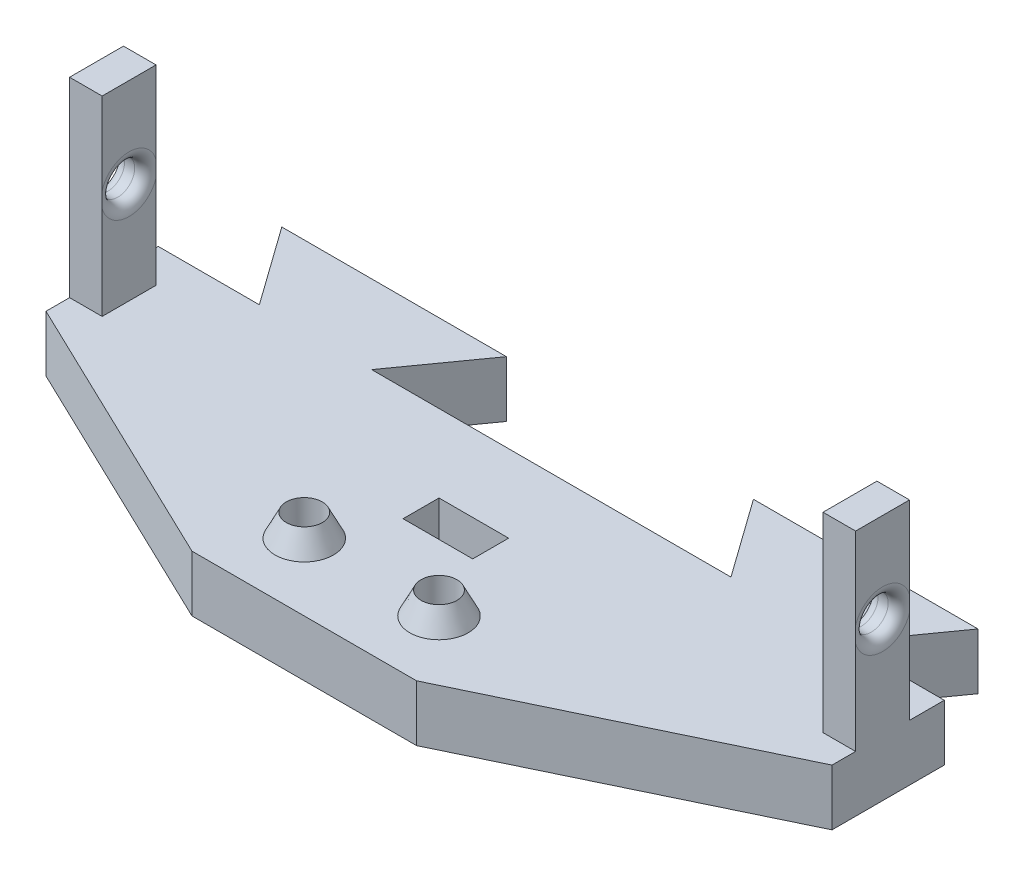
from build123d import *

# Parameters (mm, degrees)
BOSS_EXTRUDE1_DEPTH = 5
SKETCH2_R           = 1.6
CUT_EXTRUDE1_DEPTH  = 3
SKETCH10_W          = 2.9
SKETCH10_H          = 4.8
BOSS_EXTRUDE2_DEPTH = 17
SKETCH9_W           = 6.2
SKETCH9_H           = 3.2
CUT_EXTRUDE4_DEPTH  = 5
SKETCH11_R          = 1.5
CUT_EXTRUDE5_DEPTH  = 70
FILLET3_R           = 1
FILLET4_R           = 1
FILLET6_R           = 1
FILLET7_R           = 1
BOSS_EXTRUDE4_DEPTH = 5


with BuildPart() as part:
    # Sketch1 → Boss-Extrude1 (new body)
    with BuildSketch(Plane(origin=(0, 0, 0), x_dir=(1, 0, 0), z_dir=(0, 1, 0))):
        Polygon((0, 0), (20, 0), (45, 12), (45, 22), (-25, 22), (-25, 12), align=None)
    extrude(amount=BOSS_EXTRUDE1_DEPTH)

    # Sketch2 → Cut-Extrude1 (cut)
    with BuildSketch(Plane(origin=(0, 5, 0), x_dir=(1, 0, 0), z_dir=(0, 1, 0))):
        with Locations(Location((4, 6, 0), (0, 0, 270))):
            Circle(SKETCH2_R)
        with Locations(Location((16, 6, 0), (0, 0, 90))):
            Circle(SKETCH2_R)
    extrude(amount=-CUT_EXTRUDE1_DEPTH, mode=Mode.SUBTRACT)

    # Sketch6 → Revolve1 (revolve)
    with BuildSketch(Plane.XY.offset(-6), mode=Mode.PRIVATE) as revolve1_sk:
        Polygon((2.4, 5), (2.4, 7), (1.4, 5), align=None)
    revolve(revolve1_sk.sketch.rotate(Axis((4, 5, -6), (0, 1, 0)), 270), axis=Axis((4, 5, -6), (0, 1, 0)))

    # Sketch7 → Revolve2 (revolve)
    with BuildSketch(Plane.XY.offset(-6), mode=Mode.PRIVATE) as revolve2_sk:
        Polygon((14.4, 5), (14.4, 7), (13.4, 5), align=None)
    revolve(revolve2_sk.sketch.rotate(Axis((16, 5, -6), (0, 1, 0)), 270), axis=Axis((16, 5, -6), (0, 1, 0)))

    # Sketch10 → Boss-Extrude2 (add)
    with BuildSketch(Plane(origin=(0, 5, 0), x_dir=(1, 0, 0), z_dir=(0, 1, 0))):
        with Locations((-23.55, 16.5)):
            Rectangle(SKETCH10_W, SKETCH10_H)
        with Locations((43.55, 16.5)):
            Rectangle(SKETCH10_W, SKETCH10_H)
    extrude(amount=BOSS_EXTRUDE2_DEPTH)

    # Sketch9 → Cut-Extrude4 (cut)
    with BuildSketch(Plane(origin=(0, 5, 0), x_dir=(1, 0, 0), z_dir=(0, 1, 0))):
        with Locations((10, 13.5)):
            Rectangle(SKETCH9_W, SKETCH9_H)
    extrude(amount=-CUT_EXTRUDE4_DEPTH, mode=Mode.SUBTRACT)

    # Sketch11 → Cut-Extrude5 (cut)
    with BuildSketch(Plane.ZY.offset(25)):
        with Locations((-16.5, 14)):
            Circle(SKETCH11_R)
    extrude(amount=-CUT_EXTRUDE5_DEPTH, mode=Mode.SUBTRACT)

    # Fillet3
    # the kernel refuses this fillet: 1 mm, written as the material it takes off along each edge
    with BuildSketch(Plane(origin=(-25, 14, -16.5), x_dir=(0, 0, 1), z_dir=(0, -1, 0))) as fillet3_piece_1:
        with BuildLine():
            CenterArc((1.5 + FILLET3_R, -FILLET3_R), FILLET3_R, 90, 90)
            Line((1.5, -FILLET3_R), (1.5, 0))
            Line((1.5, 0), (1.5 + FILLET3_R, 0))
        make_face()
    revolve(axis=Axis((-25, 14, -16.5), (-1, 0, 0)), mode=Mode.SUBTRACT)

    # Fillet4
    # the kernel refuses this fillet: 1 mm, written as the material it takes off along each edge
    with BuildSketch(Plane(origin=(-22.1, 14, -16.5), x_dir=(0, 0, 1), z_dir=(0, -1, 0))) as fillet4_piece_1:
        with BuildLine():
            CenterArc((1.5 + FILLET4_R, FILLET4_R), FILLET4_R, 180, 90)
            Line((1.5, FILLET4_R), (1.5, 0))
            Line((1.5, 0), (1.5 + FILLET4_R, 0))
        make_face()
    revolve(axis=Axis((-22.1, 14, -16.5), (-1, 0, 0)), mode=Mode.SUBTRACT)

    # Fillet6
    # the kernel refuses this fillet: 1 mm, written as the material it takes off along each edge
    with BuildSketch(Plane(origin=(42.1, 14, -16.5), x_dir=(0, 0, 1), z_dir=(0, -1, 0))) as fillet6_piece_1:
        with BuildLine():
            CenterArc((1.5 + FILLET6_R, -FILLET6_R), FILLET6_R, 90, 90)
            Line((1.5, -FILLET6_R), (1.5, 0))
            Line((1.5, 0), (1.5 + FILLET6_R, 0))
        make_face()
    revolve(axis=Axis((42.1, 14, -16.5), (-1, 0, 0)), mode=Mode.SUBTRACT)

    # Fillet7
    # the kernel refuses this fillet: 1 mm, written as the material it takes off along each edge
    with BuildSketch(Plane(origin=(45, 14, -16.5), x_dir=(0, 0, 1), z_dir=(0, -1, 0))) as fillet7_piece_1:
        with BuildLine():
            CenterArc((1.5 + FILLET7_R, FILLET7_R), FILLET7_R, 180, 90)
            Line((1.5, FILLET7_R), (1.5, 0))
            Line((1.5, 0), (1.5 + FILLET7_R, 0))
        make_face()
    revolve(axis=Axis((45, 14, -16.5), (-1, 0, 0)), mode=Mode.SUBTRACT)

    # Sketch13 → Boss-Extrude4 (add)
    with BuildSketch(Plane(origin=(0, 5, 0), x_dir=(1, 0, 0), z_dir=(0, 1, 0))):
        Polygon((-16, 22), (-21, 29), (-1, 29), (-6, 22), align=None)
        Polygon((21, 29), (26, 22), (36, 22), (41, 29), align=None)
    extrude(amount=-BOSS_EXTRUDE4_DEPTH)


solid = part.part
